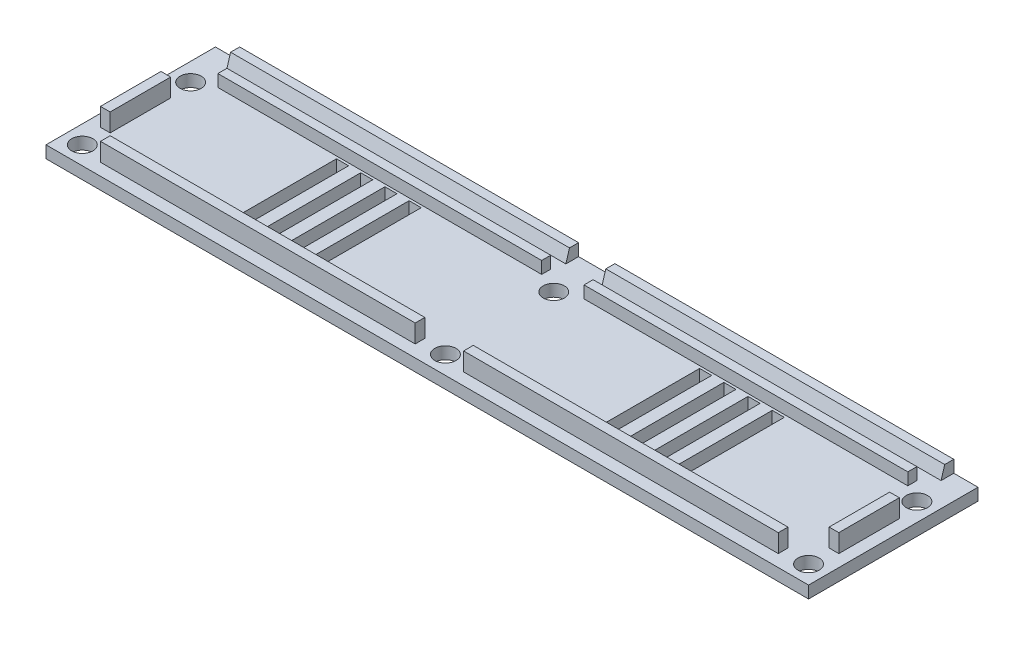
from build123d import *

# Parameters (mm, degrees)
SKIZZE1_W                       = 126
SKIZZE1_H                       = 28
AUFSATZ_LINEAR_AUSTRAGEN1_DEPTH = 2
SKIZZE2_R                       = 1.75
SCHNITT_LINEAR_AUSTRAGEN1_DEPTH = 130.089116505
SKIZZE3_W                       = 2
SKIZZE3_H                       = 16
SCHNITT_LINEAR_AUSTRAGEN2_DEPTH = 130.089116505
LINEARES_MUSTER1_COUNT          = 4
LINEARES_MUSTER1_PITCH          = 4
SKIZZE4_W                       = 2
SKIZZE4_H                       = 16
SCHNITT_LINEAR_AUSTRAGEN3_DEPTH = 130.089116505
LINEARES_MUSTER2_COUNT          = 4
LINEARES_MUSTER2_PITCH          = 4
SKIZZE5_W                       = 1.6
SKIZZE5_H                       = 10
SKIZZE5_W_2                     = 52
SKIZZE5_H_2                     = 1.6
AUFSATZ_LINEAR_AUSTRAGEN2_DEPTH = 3
SKIZZE6_W                       = 53.5
SKIZZE6_H                       = 1.5
AUFSATZ_LINEAR_AUSTRAGEN3_DEPTH = 2
SKIZZE7_W                       = 56
SKIZZE7_H                       = 2.1
AUFSATZ_LINEAR_AUSTRAGEN4_DEPTH = 2
FASE1_SIZE                      = 2
FASE1_SIZE_2                    = 0.6


with BuildPart() as part:
    # Skizze1 → Aufsatz-Linear austragen1 (new body)
    with BuildSketch(Plane(origin=(0, 0, 0), x_dir=(1, 0, 0), z_dir=(0, 1, 0))):
        with Locations((63, 14)):
            Rectangle(SKIZZE1_W, SKIZZE1_H)
    extrude(amount=AUFSATZ_LINEAR_AUSTRAGEN1_DEPTH)

    # Skizze2 → Schnitt-Linear austragen1 (cut, through all)
    with BuildSketch(Plane(origin=(0, 2, 0), x_dir=(1, 0, 0), z_dir=(0, 1, 0))):
        with Locations(Location((3, 3, 0), (0, 0, 270))):
            Circle(SKIZZE2_R)
        with Locations(Location((3, 20.9, 0), (0, 0, 270))):
            Circle(SKIZZE2_R)
        with Locations(Location((63, 3, 0), (0, 0, 270))):
            Circle(SKIZZE2_R)
        with Locations(Location((63, 20.9, 0), (0, 0, 270))):
            Circle(SKIZZE2_R)
        with Locations(Location((123, 20.9, 0), (0, 0, 270))):
            Circle(SKIZZE2_R)
        with Locations(Location((123, 3, 0), (0, 0, 270))):
            Circle(SKIZZE2_R)
    extrude(amount=-SCHNITT_LINEAR_AUSTRAGEN1_DEPTH, mode=Mode.SUBTRACT)

    # Skizze3 → Schnitt-Linear austragen2 (cut, through all)
    with BuildSketch(Plane(origin=(0, 2, 0), x_dir=(1, 0, 0), z_dir=(0, 1, 0))):
        with Locations((27, 14)):
            Rectangle(SKIZZE3_W, SKIZZE3_H)
    schnitt_linear_austragen2 = extrude(amount=-SCHNITT_LINEAR_AUSTRAGEN2_DEPTH, mode=Mode.SUBTRACT)

    # Lineares Muster1: Schnitt-Linear austragen2 ×4
    with Locations(*[(i * LINEARES_MUSTER1_PITCH, 0, 0) for i in range(1, LINEARES_MUSTER1_COUNT)]):
        add(schnitt_linear_austragen2, mode=Mode.SUBTRACT)

    # Skizze4 → Schnitt-Linear austragen3 (cut, through all)
    with BuildSketch(Plane(origin=(0, 2, 0), x_dir=(1, 0, 0), z_dir=(0, 1, 0))):
        with Locations((99, 14)):
            Rectangle(SKIZZE4_W, SKIZZE4_H)
    schnitt_linear_austragen3 = extrude(amount=-SCHNITT_LINEAR_AUSTRAGEN3_DEPTH, mode=Mode.SUBTRACT)

    # Lineares Muster2: Schnitt-Linear austragen3 ×4
    with Locations(*[(-i * LINEARES_MUSTER2_PITCH, 0, 0) for i in range(1, LINEARES_MUSTER2_COUNT)]):
        add(schnitt_linear_austragen3, mode=Mode.SUBTRACT)

    # Skizze5 → Aufsatz-Linear austragen2 (add)
    with BuildSketch(Plane(origin=(0, 2, 0), x_dir=(1, 0, 0), z_dir=(0, 1, 0))):
        with Locations((2.8, 12)):
            Rectangle(SKIZZE5_W, SKIZZE5_H)
        with Locations((33, 2.8)):
            Rectangle(SKIZZE5_W_2, SKIZZE5_H_2)
        with Locations((93, 2.8)):
            Rectangle(SKIZZE5_W_2, SKIZZE5_H_2)
        with Locations((123.2, 12)):
            Rectangle(SKIZZE5_W, SKIZZE5_H)
    extrude(amount=AUFSATZ_LINEAR_AUSTRAGEN2_DEPTH)

    # Skizze6 → Aufsatz-Linear austragen3 (add)
    with BuildSketch(Plane(origin=(0, 2, 0), x_dir=(1, 0, 0), z_dir=(0, 1, 0))):
        with Locations((32.75, 23.15)):
            Rectangle(SKIZZE6_W, SKIZZE6_H)
        with Locations((93.25, 23.15)):
            Rectangle(SKIZZE6_W, SKIZZE6_H)
    extrude(amount=AUFSATZ_LINEAR_AUSTRAGEN3_DEPTH)

    # Skizze7 → Aufsatz-Linear austragen4 (add)
    with BuildSketch(Plane(origin=(0, 2, 0), x_dir=(1, 0, 0), z_dir=(0, 1, 0))):
        with Locations((32, 26.95)):
            Rectangle(SKIZZE7_W, SKIZZE7_H)
        with Locations((94, 26.95)):
            Rectangle(SKIZZE7_W, SKIZZE7_H)
    extrude(amount=AUFSATZ_LINEAR_AUSTRAGEN4_DEPTH)

    # Fase1
    # the kernel refuses this chamfer: 2, 0.6 mm, written as the material it takes off along each edge
    with BuildSketch(Plane(origin=(127.191883336, 4, -25.9), x_dir=(0, -0.9999387354199845, 0.011069119507991545), z_dir=(-1, 0, 0))) as fase1_piece_1_section:
        Polygon((FASE1_SIZE * 0.99993873542, -FASE1_SIZE * 0.011069119508), (-FASE1_SIZE_2 * 0.011069119508, -FASE1_SIZE_2 * 0.99993873542), (0, 0), align=None)
    fase1_piece_1 = extrude(amount=66.383766671, mode=Mode.PRIVATE)
    fase1_piece_1 = split(fase1_piece_1, bisect_by=Plane(origin=(94, 2, -26.081095953), z_dir=(0, 1, 0)), keep=Keep.TOP, mode=Mode.PRIVATE)
    add(fase1_piece_1, mode=Mode.SUBTRACT)
    with BuildSketch(Plane(origin=(65.191883336, 4, -25.9), x_dir=(0, -0.9999387354199845, 0.011069119507991545), z_dir=(-1, 0, 0))) as fase1_piece_2_section:
        Polygon((FASE1_SIZE * 0.99993873542, -FASE1_SIZE * 0.011069119508), (-FASE1_SIZE_2 * 0.011069119508, -FASE1_SIZE_2 * 0.99993873542), (0, 0), align=None)
    fase1_piece_2 = extrude(amount=66.383766671, mode=Mode.PRIVATE)
    fase1_piece_2 = split(fase1_piece_2, bisect_by=Plane(origin=(32, 2, -26.081095953), z_dir=(0, 1, 0)), keep=Keep.TOP, mode=Mode.PRIVATE)
    add(fase1_piece_2, mode=Mode.SUBTRACT)


solid = part.part
